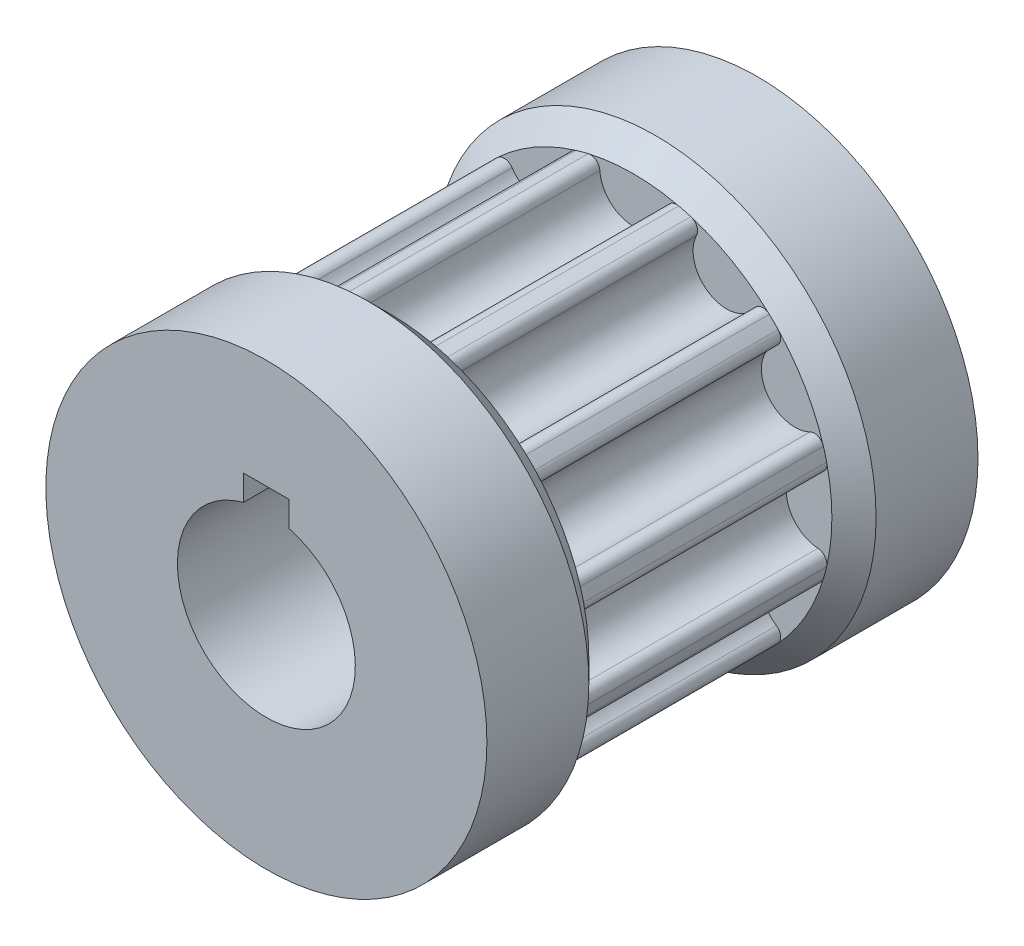
from build123d import *

# Parameters (mm, degrees)
SALIENTE_EXTRUIR1_DEPTH   = 5.5
CROQUIS5_R                = 8.98
SALIENTE_EXTRUIR2_DEPTH   = 1
SALIENTE_EXTRUIR2_DRAFT   = -45
CROQUIS8_R                = 9.98
SALIENTE_EXTRUIR3_DEPTH   = 4.61250002
SIMETR_A1_COPY_1_SKETCH_R = 8.98
SIMETR_A1_COPY_1_DEPTH    = 1
SIMETR_A1_COPY_1_DRAFT    = -45
CORTAR_EXTRUIR1_DEPTH     = 27.327769119


with BuildPart() as part:
    # Croquis3 → Saliente-Extruir1 (new, symmetric)
    with BuildSketch(Plane.XY):
        with BuildLine():
            ThreePointArc((1.522093853, 8.350897382), (1.044537818, 7.333889859), (0, 6.92))
            ThreePointArc((0, 6.92), (-1.044537818, 7.333889859), (-1.522093853, 8.350897382))
            ThreePointArc((-1.522093853, 8.350897382), (-1.69468698, 8.669418435), (-2.049408684, 8.74301573))
            ThreePointArc((-2.049408684, 8.74301573), (-2.324195025, 8.67401392), (-2.596667882, 8.596378069))
            ThreePointArc((-2.596667882, 8.596378069), (-2.867067241, 8.355280091), (-2.857276747, 7.993136203))
            ThreePointArc((-2.857276747, 7.993136203), (-2.762348644, 6.873603835), (-3.46, 5.992895794))
            ThreePointArc((-3.46, 5.992895794), (-4.571541215, 5.829066017), (-5.493620634, 6.47104235))
            ThreePointArc((-5.493620634, 6.47104235), (-5.802351194, 6.660593111), (-6.146347848, 6.546969386))
            ThreePointArc((-6.146347848, 6.546969386), (-6.349818895, 6.349818895), (-6.546969386, 6.146347848))
            ThreePointArc((-6.546969386, 6.146347848), (-6.660593111, 5.802351194), (-6.47104235, 5.493620634))
            ThreePointArc((-6.47104235, 5.493620634), (-5.829066017, 4.571541215), (-5.992895794, 3.46))
            ThreePointArc((-5.992895794, 3.46), (-6.873603835, 2.762348644), (-7.993136203, 2.857276747))
            ThreePointArc((-7.993136203, 2.857276747), (-8.355280091, 2.867067241), (-8.596378069, 2.596667882))
            ThreePointArc((-8.596378069, 2.596667882), (-8.67401392, 2.324195025), (-8.74301573, 2.049408684))
            ThreePointArc((-8.74301573, 2.049408684), (-8.669418435, 1.69468698), (-8.350897382, 1.522093853))
            ThreePointArc((-8.350897382, 1.522093853), (-7.333889859, 1.044537818), (-6.92, 0))
            ThreePointArc((-6.92, 0), (-7.333889859, -1.044537818), (-8.350897382, -1.522093853))
            ThreePointArc((-8.350897382, -1.522093853), (-8.669418435, -1.69468698), (-8.74301573, -2.049408684))
            ThreePointArc((-8.74301573, -2.049408684), (-8.67401392, -2.324195025), (-8.596378069, -2.596667882))
            ThreePointArc((-8.596378069, -2.596667882), (-8.355280091, -2.867067241), (-7.993136203, -2.857276747))
            ThreePointArc((-7.993136203, -2.857276747), (-6.873603835, -2.762348644), (-5.992895794, -3.46))
            ThreePointArc((-5.992895794, -3.46), (-5.829066017, -4.571541215), (-6.47104235, -5.493620634))
            ThreePointArc((-6.47104235, -5.493620634), (-6.660593111, -5.802351194), (-6.546969386, -6.146347848))
            ThreePointArc((-6.546969386, -6.146347848), (-6.349818895, -6.349818895), (-6.146347848, -6.546969386))
            ThreePointArc((-6.146347848, -6.546969386), (-5.802351194, -6.660593111), (-5.493620634, -6.47104235))
            ThreePointArc((-5.493620634, -6.47104235), (-4.571541215, -5.829066017), (-3.46, -5.992895794))
            ThreePointArc((-3.46, -5.992895794), (-2.762348644, -6.873603835), (-2.857276747, -7.993136203))
            ThreePointArc((-2.857276747, -7.993136203), (-2.867067241, -8.355280091), (-2.596667882, -8.596378069))
            ThreePointArc((-2.596667882, -8.596378069), (-2.324195025, -8.67401392), (-2.049408684, -8.74301573))
            ThreePointArc((-2.049408684, -8.74301573), (-1.69468698, -8.669418435), (-1.522093853, -8.350897382))
            ThreePointArc((-1.522093853, -8.350897382), (-1.044537818, -7.333889859), (0, -6.92))
            ThreePointArc((0, -6.92), (1.044537818, -7.333889859), (1.522093853, -8.350897382))
            ThreePointArc((1.522093853, -8.350897382), (1.69468698, -8.669418435), (2.049408684, -8.74301573))
            ThreePointArc((2.049408684, -8.74301573), (2.324195025, -8.67401392), (2.596667882, -8.596378069))
            ThreePointArc((2.596667882, -8.596378069), (2.867067241, -8.355280091), (2.857276747, -7.993136203))
            ThreePointArc((2.857276747, -7.993136203), (2.762348644, -6.873603835), (3.46, -5.992895794))
            ThreePointArc((3.46, -5.992895794), (4.571541215, -5.829066017), (5.493620634, -6.47104235))
            ThreePointArc((5.493620634, -6.47104235), (5.802351194, -6.660593111), (6.146347848, -6.546969386))
            ThreePointArc((6.146347848, -6.546969386), (6.349818895, -6.349818895), (6.546969386, -6.146347848))
            ThreePointArc((6.546969386, -6.146347848), (6.660593111, -5.802351194), (6.47104235, -5.493620634))
            ThreePointArc((6.47104235, -5.493620634), (5.829066017, -4.571541215), (5.992895794, -3.46))
            ThreePointArc((5.992895794, -3.46), (6.873603835, -2.762348644), (7.993136203, -2.857276747))
            ThreePointArc((7.993136203, -2.857276747), (8.355280091, -2.867067241), (8.596378069, -2.596667882))
            ThreePointArc((8.596378069, -2.596667882), (8.67401392, -2.324195025), (8.74301573, -2.049408684))
            ThreePointArc((8.74301573, -2.049408684), (8.669418435, -1.69468698), (8.350897382, -1.522093853))
            ThreePointArc((8.350897382, -1.522093853), (7.333889859, -1.044537818), (6.92, 0))
            ThreePointArc((6.92, 0), (7.333889859, 1.044537818), (8.350897382, 1.522093853))
            ThreePointArc((8.350897382, 1.522093853), (8.669418435, 1.69468698), (8.74301573, 2.049408684))
            ThreePointArc((8.74301573, 2.049408684), (8.67401392, 2.324195025), (8.596378069, 2.596667882))
            ThreePointArc((8.596378069, 2.596667882), (8.355280091, 2.867067241), (7.993136203, 2.857276747))
            ThreePointArc((7.993136203, 2.857276747), (6.873603835, 2.762348644), (5.992895794, 3.46))
            ThreePointArc((5.992895794, 3.46), (5.829066017, 4.571541215), (6.47104235, 5.493620634))
            ThreePointArc((6.47104235, 5.493620634), (6.660593111, 5.802351194), (6.546969386, 6.146347848))
            ThreePointArc((6.546969386, 6.146347848), (6.349818895, 6.349818895), (6.146347848, 6.546969386))
            ThreePointArc((6.146347848, 6.546969386), (5.802351194, 6.660593111), (5.493620634, 6.47104235))
            ThreePointArc((5.493620634, 6.47104235), (4.571541215, 5.829066017), (3.46, 5.992895794))
            ThreePointArc((3.46, 5.992895794), (2.762348644, 6.873603835), (2.857276747, 7.993136203))
            ThreePointArc((2.857276747, 7.993136203), (2.867067241, 8.355280091), (2.596667882, 8.596378069))
            ThreePointArc((2.596667882, 8.596378069), (2.324195025, 8.67401392), (2.049408684, 8.74301573))
            ThreePointArc((2.049408684, 8.74301573), (1.69468698, 8.669418435), (1.522093853, 8.350897382))
        make_face()
    extrude(amount=SALIENTE_EXTRUIR1_DEPTH, both=True)


with BuildPart() as saliente_extruir2_tool:
    # Croquis5 → Saliente-Extruir2 (with draft: the straight prism first)
    with BuildSketch(Plane.XY.offset(5.5)):
        Circle(CROQUIS5_R)
    extrude(amount=SALIENTE_EXTRUIR2_DEPTH)
    # Saliente-Extruir2: the draft: its side faces are tilted about the plane it starts from
    saliente_extruir2_sides = [saliente_extruir2_tool.faces().sort_by_distance(p)[0] for p in [
        (-8.98, 0, 6),
    ]]
    draft(saliente_extruir2_sides, Plane.XY.offset(5.5), SALIENTE_EXTRUIR2_DRAFT)


with BuildPart() as part_1:
    add(part.part)

    # Saliente-Extruir2: add saliente_extruir2_tool
    add(saliente_extruir2_tool.part)

    # Croquis8 → Saliente-Extruir3 (add)
    with BuildSketch(Plane.XY.offset(6.5)):
        Circle(CROQUIS8_R)
    saliente_extruir3 = extrude(amount=SALIENTE_EXTRUIR3_DEPTH)

    # Simetría1: Saliente-Extruir3 across plane
    add(saliente_extruir3.mirror(Plane.XY))


with BuildPart() as simetr_a1_copy_1_tool:
    # Simetría1 copy 1 sketch → Simetría1 copy 1 (with draft: the straight prism first)
    with BuildSketch(Plane(origin=(0, 0, -5.5), x_dir=(1, 0, 0), z_dir=(0, 0, -1))):
        Circle(SIMETR_A1_COPY_1_SKETCH_R)
    extrude(amount=SIMETR_A1_COPY_1_DEPTH)
    # Simetría1 copy 1: the draft: its side faces are tilted about the plane it starts from
    simetr_a1_copy_1_sides = [simetr_a1_copy_1_tool.faces().sort_by_distance(p)[0] for p in [
        (-8.98, 0, -6),
    ]]
    draft(simetr_a1_copy_1_sides, Plane(origin=(0, 0, -5.5), x_dir=(1, 0, 0), z_dir=(0, 0, -1)), SIMETR_A1_COPY_1_DRAFT)


with BuildPart() as part_2:
    add(part_1.part)

    # Simetría1 copy 1: add simetr_a1_copy_1_tool
    add(simetr_a1_copy_1_tool.part)

    # Croquis6 → Cortar-Extruir1 (cut, through all)
    with BuildSketch(Plane.XY.offset(11.11250002)):
        with BuildLine():
            Line((-1.035, 3.889652941), (-1.035, 5.04))
            Line((-1.035, 5.04), (1.035, 5.04))
            Line((1.035, 5.04), (1.035, 3.889652941))
            ThreePointArc((1.035, 3.889652941), (0, -4.025), (-1.035, 3.889652941))
        make_face()
    extrude(amount=-CORTAR_EXTRUIR1_DEPTH, mode=Mode.SUBTRACT)


solid = part_2.part
